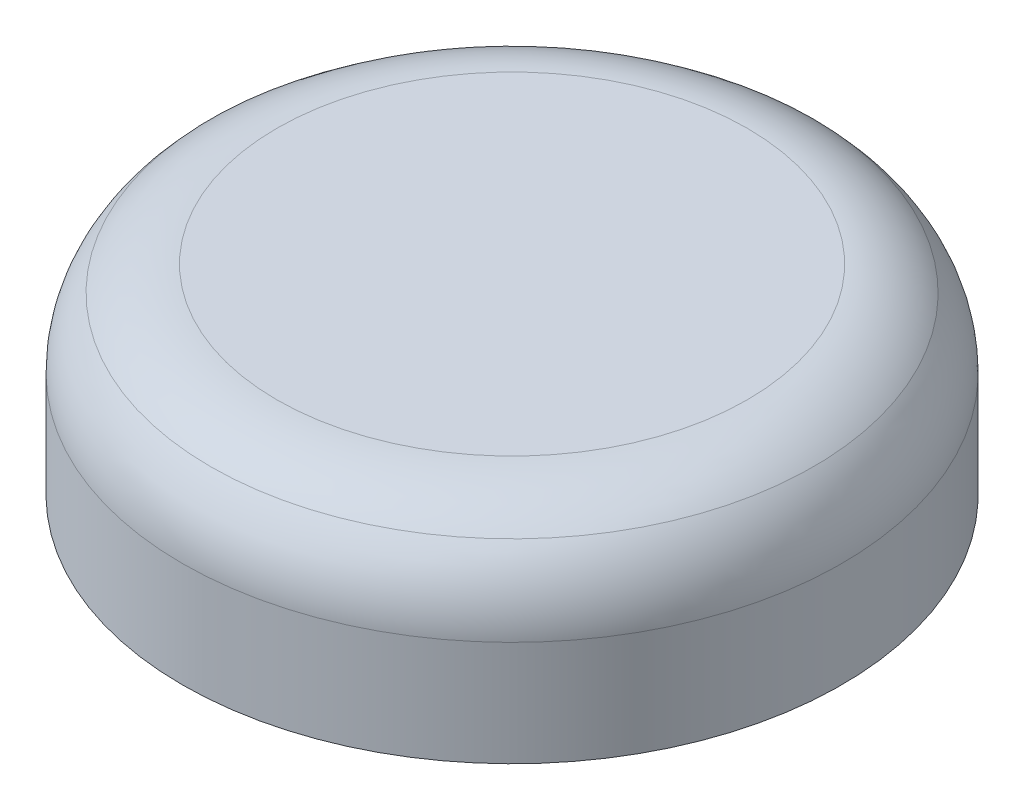
from build123d import *

# Parameters (mm, degrees)
SKETCH1_R                      = 33
SKETCH1_R_2                    = 30
BOSS_EXTRUDE2_DEPTH            = 15
BOSS_EXTRUDE3_REACH            = 52.774
BOSS_EXTRUDE3_END_MAJOR_RADIUS = 23.22782186
BOSS_EXTRUDE3_END_MINOR_RADIUS = 10
SKETCH4_R                      = 25.5
SKETCH4_R_2                    = 22.55
FILLET1_R                      = 10


with BuildPart() as part:
    # Sketch1 → Boss-Extrude2 (new body)
    with BuildSketch(Plane(origin=(0, 0, 0), x_dir=(1, 0, 0), z_dir=(0, 1, 0))):
        with Locations(Location((0, 0, 0), (0, 0, 270))):
            Circle(SKETCH1_R)
        with Locations(Location((0, 0, 0), (0, 0, 270))):
            Circle(SKETCH1_R_2, mode=Mode.SUBTRACT)
    extrude(amount=BOSS_EXTRUDE2_DEPTH)

    # Sketch3 → Revolve1 (revolve)
    with BuildSketch(Plane.XY, mode=Mode.PRIVATE) as revolve1_sk:
        with BuildLine():
            Line((0, 20), (-23.550888175, 20))
            ThreePointArc((-23.550888175, 20), (-27.086422081, 19.354143467), (-30.165266452, 17.5))
            Line((-30.165266452, 17.5), (-33, 15))
            Line((-33, 15), (-30, 15))
            Line((-30, 15), (-28.792397579, 15.80876026))
            ThreePointArc((-28.792397579, 15.80876026), (-26.135776243, 17.067852492), (-23.22782186, 17.5))
            Line((-23.22782186, 17.5), (0, 17.5))
            Line((0, 17.5), (0, 20))
        make_face()
    revolve(revolve1_sk.sketch.rotate(Axis((0, 15, 0), (0, 1, 0)), 270), axis=Axis((0, 15, 0), (0, 1, 0)))

    # Boss-Extrude3: up to this torus (the profile starts inside it)
    boss_extrude3_end = Plane(origin=(0, 7.5, 0), z_dir=(0, -1, 0)) * Torus(BOSS_EXTRUDE3_END_MAJOR_RADIUS, BOSS_EXTRUDE3_END_MINOR_RADIUS, mode=Mode.PRIVATE)
    # Sketch4 → Boss-Extrude3 (add, up to the surface)
    with BuildSketch(Plane.XZ, mode=Mode.PRIVATE) as boss_extrude3_sk1:
        with Locations(Location((0, 0, 0), (0, 0, 270))):
            Circle(SKETCH4_R)
        with Locations(Location((0, 0, 0), (0, 0, 270))):
            Circle(SKETCH4_R_2, mode=Mode.SUBTRACT)
    boss_extrude3_tool1 = extrude(boss_extrude3_sk1.sketch, amount=-BOSS_EXTRUDE3_REACH, mode=Mode.PRIVATE) & boss_extrude3_end
    add(boss_extrude3_tool1.solids().sort_by_distance((0, 0, 24.778751))[0])

    # Fillet1
    # the kernel refuses this fillet: 10 mm, written as the material it takes off along each edge
    with BuildSketch(Plane(origin=(0, 15, 0), x_dir=(0, 0, -1), z_dir=(1, 0, 0))) as fillet1_piece_1:
        with BuildLine():
            CenterArc((23, -4.475597226), FILLET1_R, 0, 44.231546617)
            Line((30.165266452, 2.5), (30.308571781, 2.639511945))
            ThreePointArc((30.308571781, 2.639511945), (31.714920792, 1.4), (33.132287566, 0.15))
            Line((33.132287566, 0.15), (33.2, 0))
            Line((33.2, 0), (33.2, -4.475597226))
            Line((33.2, -4.475597226), (33, -4.475597226))
        make_face()
    revolve(axis=Axis((0, 15, 0), (0, 1, 0)), revolution_arc=180, mode=Mode.SUBTRACT)
    with BuildSketch(Plane(origin=(0, 15, 0), x_dir=(0, 0, 1), z_dir=(-1, 0, 0))) as fillet1_piece_2:
        with BuildLine():
            CenterArc((23, -4.475597226), FILLET1_R, 0, 44.231546617)
            Line((30.165266452, 2.5), (30.308571781, 2.639511945))
            ThreePointArc((30.308571781, 2.639511945), (31.714920792, 1.4), (33.132287566, 0.15))
            Line((33.132287566, 0.15), (33.2, 0))
            Line((33.2, 0), (33.2, -4.475597226))
            Line((33.2, -4.475597226), (33, -4.475597226))
        make_face()
    revolve(axis=Axis((0, 15, 0), (0, 1, 0)), revolution_arc=180, mode=Mode.SUBTRACT)


solid = part.part
